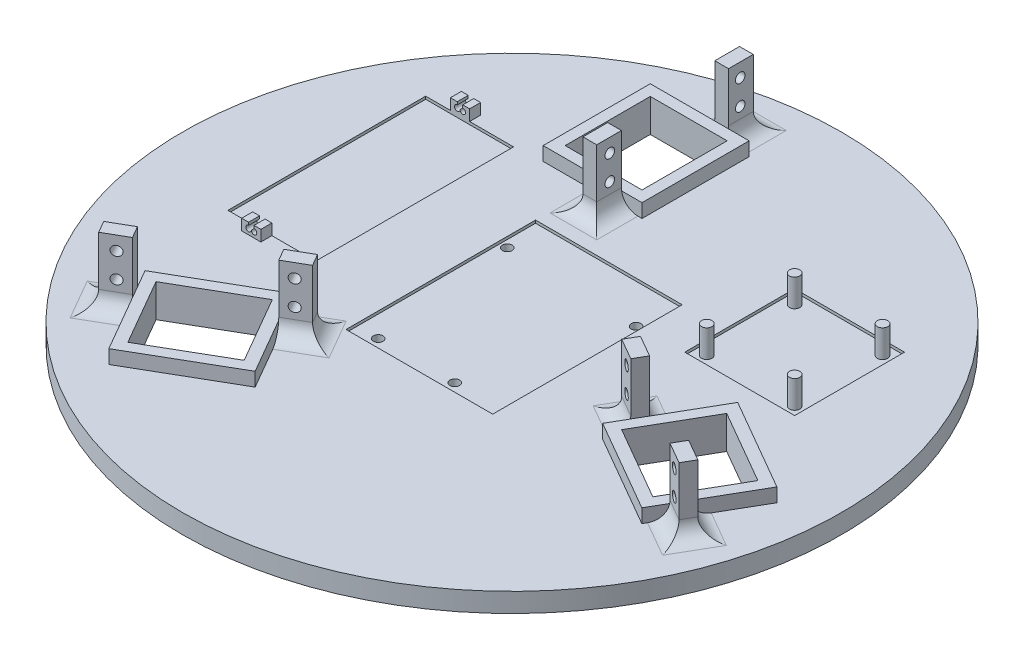
from build123d import *

# Parameters (mm, degrees)
SKETCH1_R                = 120
BOSS_EXTRUDE1_DEPTH      = 7
SKETCH2_W                = 32
SKETCH2_H                = 72
SKETCH2_W_2              = 53.4
SKETCH2_H_2              = 69
SKETCH2_W_3              = 40
SKETCH2_H_3              = 40
CUT_EXTRUDE3_DEPTH       = 1
SKETCH2_5_W              = 36
SKETCH2_5_H              = 39
BOSS_EXTRUDE2_DEPTH      = 5
BOSS_EXTRUDE3_DEPTH      = 24
FILLET1_R                = 6
CUT_EXTRUDE4_REACH       = 195.107
SKETCH4_R                = 1.75
SKETCH2_6_W              = 7
SKETCH2_6_H              = 4
BOSS_EXTRUDE4_DEPTH      = 3
CUT_EXTRUDE7_REACH       = 220.211
SKETCH11_W               = 2.500006305
SKETCH11_H               = 4
SKETCH11_W_2             = 2.500003153
BOSS_EXTRUDE5_DEPTH      = 1
SKETCH12_R               = 1.9
BOSS_EXTRUDE6_DEPTH      = 10
CUT_EXTRUDE8_DEPTH       = 172.394282285
CUT_EXTRUDE8_DEPTH_BACK  = 172.394282285
SKETCH13_W               = 28
SKETCH13_H               = 31
CIRPATTERN2_COUNT        = 3
FILLET1_OF_CIRPATTERN2_R = 6
SKETCH15_R               = 1.75
CUT_EXTRUDE9_DEPTH       = 172.537167984
CUT_EXTRUDE10_START      = -6
SKETCH16_W               = 53.4
SKETCH16_H               = 69
CUT_EXTRUDE10_DEPTH      = 3


with BuildPart() as part:
    # Sketch1 → Boss-Extrude1 (new body)
    with BuildSketch(Plane(origin=(0, 0, 0), x_dir=(1, 0, 0), z_dir=(0, 1, 0))):
        with Locations(Location((0, 0, 0), (0, 0, 270))):
            Circle(SKETCH1_R)
    extrude(amount=BOSS_EXTRUDE1_DEPTH)

    # Sketch2 → Cut-Extrude3 (cut)
    with BuildSketch(Plane(origin=(0, 7, 0), x_dir=(1, 0, 0), z_dir=(0, 1, 0))):
        with Locations((-71.029666422, 19.596326751)):
            Rectangle(SKETCH2_W, SKETCH2_H)
        with Locations((-1.243041985, 2.015923887)):
            Rectangle(SKETCH2_W_2, SKETCH2_H_2)
        with Locations((60.875562307, 42.044954151)):
            Rectangle(SKETCH2_W_3, SKETCH2_H_3)
    extrude(amount=-CUT_EXTRUDE3_DEPTH, mode=Mode.SUBTRACT)

    # Sketch2<5> → Boss-Extrude2 (add)
    with BuildSketch(Plane(origin=(0, 7, 0), x_dir=(1, 0, 0), z_dir=(0, 1, 0))):
        with Locations((-27.05, 75.897838026)):
            Rectangle(SKETCH2_5_W, SKETCH2_5_H)
        Polygon((-60.091951196, -86.713363453), (-78.091951196, -55.536448917), (-44.316960449, -36.036448917), (-26.316960449, -67.213363453), align=None)
        Polygon((105.141951196, -8.684474572), (87.141951196, -39.861389109), (53.366960449, -20.361389109), (71.366960449, 10.815525428), align=None)
    extrude(amount=BOSS_EXTRUDE2_DEPTH)

    # Sketch3 → Boss-Extrude3 (add)
    with BuildSketch(Plane(origin=(0, 7, 0), x_dir=(1, 0, 0), z_dir=(0, 1, 0))):
        Polygon((-74.341951196, -62.031639446), (-82.136179831, -66.531639446), (-79.636179831, -70.861766464), (-71.841951196, -66.361766464), align=None)
        Polygon((-40.566960449, -42.531639446), (-32.772731815, -38.031639446), (-30.272731815, -42.361766464), (-38.066960449, -46.861766464), align=None)
    boss_extrude3 = extrude(amount=BOSS_EXTRUDE3_DEPTH)

    # Fillet1
    # the kernel refuses this fillet: 6 mm, written as the material it adds along each edge
    with BuildSketch(Plane(origin=(-30.272731815, 7, 42.361766464), x_dir=(0.4999999999999997, 0, 0.8660254037844387), z_dir=(-0.8660254037844388, 0, 0.4999999999999998)), Plane(origin=(-40.566960449, 7, 42.531639446), x_dir=(-0.500000000000001, 0, -0.866025403784438), z_dir=(0.8660254037844382, 0, -0.500000000000001))) as fillet1_piece_1:
        with BuildLine():
            CenterArc((FILLET1_R, FILLET1_R), FILLET1_R, 180, 90)
            Line((0, FILLET1_R), (-FILLET1_R * 0.02, FILLET1_R))
            Line((-FILLET1_R * 0.02, FILLET1_R), (-FILLET1_R * 0.02, -FILLET1_R * 0.02))
            Line((-FILLET1_R * 0.02, -FILLET1_R * 0.02), (FILLET1_R, -FILLET1_R * 0.02))
            Line((FILLET1_R, -FILLET1_R * 0.02), (FILLET1_R, 0))
        make_face()
    extrude(amount=9)
    with BuildSketch(Plane(origin=(-32.772731815, 7, 38.031639446), x_dir=(0.8660254037844393, 0, -0.49999999999999895), z_dir=(0.499999999999999, 0, 0.8660254037844393))) as fillet1_piece_2:
        with BuildLine():
            CenterArc((FILLET1_R, FILLET1_R), FILLET1_R, 180, 90)
            Line((0, FILLET1_R), (-FILLET1_R * 0.02, FILLET1_R))
            Line((-FILLET1_R * 0.02, FILLET1_R), (-FILLET1_R * 0.02, -FILLET1_R * 0.02))
            Line((-FILLET1_R * 0.02, -FILLET1_R * 0.02), (FILLET1_R, -FILLET1_R * 0.02))
            Line((FILLET1_R, -FILLET1_R * 0.02), (FILLET1_R, 0))
        make_face()
    extrude(amount=5)
    with BuildSketch(Plane(origin=(-74.341951196, 7, 62.031639446), x_dir=(-0.5000000000000006, 0, -0.8660254037844384), z_dir=(-0.8660254037844384, 0, 0.5000000000000006)), Plane(origin=(-79.636179831, 7, 70.861766464), x_dir=(0.5, 0, 0.8660254037844387), z_dir=(0.8660254037844387, 0, -0.5))) as fillet1_piece_3:
        with BuildLine():
            CenterArc((FILLET1_R, -FILLET1_R), FILLET1_R, 90, 90)
            Line((0, -FILLET1_R), (-FILLET1_R * 0.02, -FILLET1_R))
            Line((-FILLET1_R * 0.02, -FILLET1_R), (-FILLET1_R * 0.02, FILLET1_R * 0.02))
            Line((-FILLET1_R * 0.02, FILLET1_R * 0.02), (FILLET1_R, FILLET1_R * 0.02))
            Line((FILLET1_R, FILLET1_R * 0.02), (FILLET1_R, 0))
        make_face()
    extrude(amount=9)
    with BuildSketch(Plane(origin=(-82.136179831, 7, 66.531639446), x_dir=(-0.8660254037844376, 0, 0.5000000000000018), z_dir=(0.5000000000000018, 0, 0.8660254037844377))) as fillet1_piece_4:
        with BuildLine():
            CenterArc((FILLET1_R, -FILLET1_R), FILLET1_R, 90, 90)
            Line((0, -FILLET1_R), (-FILLET1_R * 0.02, -FILLET1_R))
            Line((-FILLET1_R * 0.02, -FILLET1_R), (-FILLET1_R * 0.02, FILLET1_R * 0.02))
            Line((-FILLET1_R * 0.02, FILLET1_R * 0.02), (FILLET1_R, FILLET1_R * 0.02))
            Line((FILLET1_R, FILLET1_R * 0.02), (FILLET1_R, 0))
        make_face()
    extrude(amount=5)
    with BuildSketch(Plane(origin=(-17.282350758, 7, 34.861766464), x_dir=(0.4999999999999997, 0, 0.8660254037844388), z_dir=(-0.8660254037844388, 0, 0.4999999999999998))) as fillet1_piece_5a_section:
        with BuildLine():
            CenterArc((FILLET1_R, FILLET1_R), FILLET1_R, 180, 90)
            Line((0, FILLET1_R), (-FILLET1_R * 0.02, FILLET1_R))
            Line((-FILLET1_R * 0.02, FILLET1_R), (-FILLET1_R * 0.02, -FILLET1_R * 0.02))
            Line((-FILLET1_R * 0.02, -FILLET1_R * 0.02), (FILLET1_R, -FILLET1_R * 0.02))
            Line((FILLET1_R, -FILLET1_R * 0.02), (FILLET1_R, 0))
        make_face()
    fillet1_piece_5a = extrude(amount=24, mode=Mode.PRIVATE)
    fillet1_piece_5a = split(fillet1_piece_5a, bisect_by=Plane(origin=(-29.593546472, 8.358370686, 43.538149986), z_dir=(0.8660254037844393, 0, -0.499999999999999)), keep=Keep.TOP, mode=Mode.PRIVATE)
    with BuildSketch(Plane(origin=(-32.772731815, 7, 38.031639446), x_dir=(0.8660254037844393, 0, -0.49999999999999895), z_dir=(0.499999999999999, 0, 0.8660254037844393))) as fillet1_piece_5b_section:
        with BuildLine():
            CenterArc((FILLET1_R, FILLET1_R), FILLET1_R, 180, 90)
            Line((0, FILLET1_R), (-FILLET1_R * 0.02, FILLET1_R))
            Line((-FILLET1_R * 0.02, FILLET1_R), (-FILLET1_R * 0.02, -FILLET1_R * 0.02))
            Line((-FILLET1_R * 0.02, -FILLET1_R * 0.02), (FILLET1_R, -FILLET1_R * 0.02))
            Line((FILLET1_R, -FILLET1_R * 0.02), (FILLET1_R, 0))
        make_face()
    fillet1_piece_5b = extrude(amount=20, mode=Mode.PRIVATE)
    fillet1_piece_5b = split(fillet1_piece_5b, bisect_by=Plane(origin=(-29.096348293, 8.358370686, 41.682581122), z_dir=(0.4999999999999998, 0, 0.8660254037844388)), keep=Keep.TOP, mode=Mode.PRIVATE)
    fillet1_piece_5 = fillet1_piece_5a & fillet1_piece_5b
    add(fillet1_piece_5)
    with BuildSketch(Plane(origin=(-40.272731815, 7, 25.041258389), x_dir=(0.8660254037844392, 0, -0.4999999999999989), z_dir=(0.499999999999999, 0, 0.8660254037844393))) as fillet1_piece_6a_section:
        with BuildLine():
            CenterArc((FILLET1_R, FILLET1_R), FILLET1_R, 180, 90)
            Line((0, FILLET1_R), (-FILLET1_R * 0.02, FILLET1_R))
            Line((-FILLET1_R * 0.02, FILLET1_R), (-FILLET1_R * 0.02, -FILLET1_R * 0.02))
            Line((-FILLET1_R * 0.02, -FILLET1_R * 0.02), (FILLET1_R, -FILLET1_R * 0.02))
            Line((FILLET1_R, -FILLET1_R * 0.02), (FILLET1_R, 0))
        make_face()
    fillet1_piece_6a = extrude(amount=20, mode=Mode.PRIVATE)
    fillet1_piece_6a = split(fillet1_piece_6a, bisect_by=Plane(origin=(-31.596348293, 8.358370686, 37.352454103), z_dir=(-0.500000000000001, 0, -0.8660254037844382)), keep=Keep.TOP, mode=Mode.PRIVATE)
    with BuildSketch(Plane(origin=(-40.566960449, 7, 42.531639446), x_dir=(-0.500000000000001, 0, -0.866025403784438), z_dir=(0.8660254037844382, 0, -0.500000000000001))) as fillet1_piece_6b_section:
        with BuildLine():
            CenterArc((FILLET1_R, FILLET1_R), FILLET1_R, 180, 90)
            Line((0, FILLET1_R), (-FILLET1_R * 0.02, FILLET1_R))
            Line((-FILLET1_R * 0.02, FILLET1_R), (-FILLET1_R * 0.02, -FILLET1_R * 0.02))
            Line((-FILLET1_R * 0.02, -FILLET1_R * 0.02), (FILLET1_R, -FILLET1_R * 0.02))
            Line((FILLET1_R, -FILLET1_R * 0.02), (FILLET1_R, 0))
        make_face()
    fillet1_piece_6b = extrude(amount=24, mode=Mode.PRIVATE)
    fillet1_piece_6b = split(fillet1_piece_6b, bisect_by=Plane(origin=(-33.451917158, 8.358370686, 36.855255924), z_dir=(0.8660254037844393, 0, -0.499999999999999)), keep=Keep.TOP, mode=Mode.PRIVATE)
    fillet1_piece_6 = fillet1_piece_6a & fillet1_piece_6b
    add(fillet1_piece_6)
    with BuildSketch(Plane(origin=(-74.341951196, 7, 62.031639446), x_dir=(-0.5000000000000006, 0, -0.8660254037844384), z_dir=(-0.8660254037844384, 0, 0.5000000000000006))) as fillet1_piece_7a_section:
        with BuildLine():
            CenterArc((FILLET1_R, -FILLET1_R), FILLET1_R, 90, 90)
            Line((0, -FILLET1_R), (-FILLET1_R * 0.02, -FILLET1_R))
            Line((-FILLET1_R * 0.02, -FILLET1_R), (-FILLET1_R * 0.02, FILLET1_R * 0.02))
            Line((-FILLET1_R * 0.02, FILLET1_R * 0.02), (FILLET1_R, FILLET1_R * 0.02))
            Line((FILLET1_R, FILLET1_R * 0.02), (FILLET1_R, 0))
        make_face()
    fillet1_piece_7a = extrude(amount=24, mode=Mode.PRIVATE)
    fillet1_piece_7a = split(fillet1_piece_7a, bisect_by=Plane(origin=(-82.815365173, 8.358370686, 65.355255924), z_dir=(-0.8660254037844377, 0, 0.5000000000000018)), keep=Keep.TOP, mode=Mode.PRIVATE)
    with BuildSketch(Plane(origin=(-89.636179831, 7, 53.541258389), x_dir=(-0.8660254037844376, 0, 0.5000000000000017), z_dir=(0.5000000000000018, 0, 0.8660254037844377))) as fillet1_piece_7b_section:
        with BuildLine():
            CenterArc((FILLET1_R, -FILLET1_R), FILLET1_R, 90, 90)
            Line((0, -FILLET1_R), (-FILLET1_R * 0.02, -FILLET1_R))
            Line((-FILLET1_R * 0.02, -FILLET1_R), (-FILLET1_R * 0.02, FILLET1_R * 0.02))
            Line((-FILLET1_R * 0.02, FILLET1_R * 0.02), (FILLET1_R, FILLET1_R * 0.02))
            Line((FILLET1_R, FILLET1_R * 0.02), (FILLET1_R, 0))
        make_face()
    fillet1_piece_7b = extrude(amount=20, mode=Mode.PRIVATE)
    fillet1_piece_7b = split(fillet1_piece_7b, bisect_by=Plane(origin=(-83.312563352, 8.358370686, 67.210824788), z_dir=(-0.5000000000000006, 0, -0.8660254037844384)), keep=Keep.TOP, mode=Mode.PRIVATE)
    fillet1_piece_7 = fillet1_piece_7a & fillet1_piece_7b
    add(fillet1_piece_7)
    with BuildSketch(Plane(origin=(-82.136179831, 7, 66.531639446), x_dir=(-0.8660254037844376, 0, 0.5000000000000018), z_dir=(0.5000000000000018, 0, 0.8660254037844377))) as fillet1_piece_8a_section:
        with BuildLine():
            CenterArc((FILLET1_R, -FILLET1_R), FILLET1_R, 90, 90)
            Line((0, -FILLET1_R), (-FILLET1_R * 0.02, -FILLET1_R))
            Line((-FILLET1_R * 0.02, -FILLET1_R), (-FILLET1_R * 0.02, FILLET1_R * 0.02))
            Line((-FILLET1_R * 0.02, FILLET1_R * 0.02), (FILLET1_R, FILLET1_R * 0.02))
            Line((FILLET1_R, FILLET1_R * 0.02), (FILLET1_R, 0))
        make_face()
    fillet1_piece_8a = extrude(amount=20, mode=Mode.PRIVATE)
    fillet1_piece_8a = split(fillet1_piece_8a, bisect_by=Plane(origin=(-80.812563352, 8.358370686, 71.540951807), z_dir=(0.5, 0, 0.8660254037844387)), keep=Keep.TOP, mode=Mode.PRIVATE)
    with BuildSketch(Plane(origin=(-92.626560887, 7, 78.361766464), x_dir=(0.5, 0, 0.8660254037844387), z_dir=(0.8660254037844387, 0, -0.5))) as fillet1_piece_8b_section:
        with BuildLine():
            CenterArc((FILLET1_R, -FILLET1_R), FILLET1_R, 90, 90)
            Line((0, -FILLET1_R), (-FILLET1_R * 0.02, -FILLET1_R))
            Line((-FILLET1_R * 0.02, -FILLET1_R), (-FILLET1_R * 0.02, FILLET1_R * 0.02))
            Line((-FILLET1_R * 0.02, FILLET1_R * 0.02), (FILLET1_R, FILLET1_R * 0.02))
            Line((FILLET1_R, FILLET1_R * 0.02), (FILLET1_R, 0))
        make_face()
    fillet1_piece_8b = extrude(amount=24, mode=Mode.PRIVATE)
    fillet1_piece_8b = split(fillet1_piece_8b, bisect_by=Plane(origin=(-78.956994488, 8.358370686, 72.038149986), z_dir=(-0.8660254037844377, 0, 0.5000000000000018)), keep=Keep.TOP, mode=Mode.PRIVATE)
    fillet1_piece_8 = fillet1_piece_8a & fillet1_piece_8b
    add(fillet1_piece_8)

    # Sketch4 → Cut-Extrude4 (cut, up to next)
    with BuildSketch(Plane(origin=(10.775, 0, 18.662847452), x_dir=(0.8660254037844384, 0, -0.5000000000000006), z_dir=(0.5000000000000006, 0, 0.8660254037844385)), mode=Mode.PRIVATE) as cut_extrude4_sk1:
        with Locations((-52.147838026, 26)):
            Circle(SKETCH4_R)
    cut_extrude4_tool1 = extrude(cut_extrude4_sk1.sketch, amount=-CUT_EXTRUDE4_REACH, mode=Mode.PRIVATE) & part.part
    # Sketch4 → Cut-Extrude4 (cut, up to next)
    with BuildSketch(Plane(origin=(10.775, 0, 18.662847452), x_dir=(0.8660254037844384, 0, -0.5000000000000006), z_dir=(0.5000000000000006, 0, 0.8660254037844385)), mode=Mode.PRIVATE) as cut_extrude4_sk2:
        with Locations((-52.147838026, 17)):
            Circle(SKETCH4_R)
    cut_extrude4_tool2 = extrude(cut_extrude4_sk2.sketch, amount=-CUT_EXTRUDE4_REACH, mode=Mode.PRIVATE) & part.part
    # Sketch4 → Cut-Extrude4 (cut, up to next)
    with BuildSketch(Plane(origin=(10.775, 0, 18.662847452), x_dir=(0.8660254037844384, 0, -0.5000000000000006), z_dir=(0.5000000000000006, 0, 0.8660254037844385)), mode=Mode.PRIVATE) as cut_extrude4_sk3:
        with Locations((-99.647838026, 26)):
            Circle(SKETCH4_R)
    cut_extrude4_tool3 = extrude(cut_extrude4_sk3.sketch, amount=-CUT_EXTRUDE4_REACH, mode=Mode.PRIVATE) & part.part
    # Sketch4 → Cut-Extrude4 (cut, up to next)
    with BuildSketch(Plane(origin=(10.775, 0, 18.662847452), x_dir=(0.8660254037844384, 0, -0.5000000000000006), z_dir=(0.5000000000000006, 0, 0.8660254037844385)), mode=Mode.PRIVATE) as cut_extrude4_sk4:
        with Locations((-99.647838026, 17)):
            Circle(SKETCH4_R)
    cut_extrude4_tool4 = extrude(cut_extrude4_sk4.sketch, amount=-CUT_EXTRUDE4_REACH, mode=Mode.PRIVATE) & part.part
    cut_extrude4_1 = cut_extrude4_tool1.solids().sort_by_distance((-34.386352, 26, 44.736766))[0]
    add(cut_extrude4_1, mode=Mode.SUBTRACT)
    cut_extrude4_2 = cut_extrude4_tool2.solids().sort_by_distance((-34.386352, 17, 44.736766))[0]
    add(cut_extrude4_2, mode=Mode.SUBTRACT)
    cut_extrude4_3 = cut_extrude4_tool3.solids().sort_by_distance((-75.522559, 26, 68.486766))[0]
    add(cut_extrude4_3, mode=Mode.SUBTRACT)
    cut_extrude4_4 = cut_extrude4_tool4.solids().sort_by_distance((-75.522559, 17, 68.486766))[0]
    add(cut_extrude4_4, mode=Mode.SUBTRACT)
    cut_extrude4 = cut_extrude4_1 + cut_extrude4_2 + cut_extrude4_3 + cut_extrude4_4  # Cut-Extrude4 as one shape, for the pattern or mirror that repeats it

    # Sketch2<6> → Boss-Extrude4 (add)
    with BuildSketch(Plane(origin=(0, 7, 0), x_dir=(1, 0, 0), z_dir=(0, 1, 0))):
        with Locations((-74.529666422, 57.596326751)):
            Rectangle(SKETCH2_6_W, SKETCH2_6_H)
        with Locations((-74.529666422, -18.403673249)):
            Rectangle(SKETCH2_6_W, SKETCH2_6_H)
    extrude(amount=BOSS_EXTRUDE4_DEPTH)

    # Cut-Extrude7: up to this face of the body (flat: up to its plane)
    cut_extrude7_end = Plane(part.part.faces().sort_by_distance((-74.529666422, 8.5, 20.403673249))[0])
    # Sketch10 → Cut-Extrude7 (cut, up to the picked face)
    with BuildSketch(Plane(origin=(0, 0, -59.596326751), x_dir=(-1, 0, 0), z_dir=(0, 0, -1)), mode=Mode.PRIVATE) as cut_extrude7_sk1:
        with BuildLine():
            Line((73.529672727, 10), (75.529660117, 10))
            ThreePointArc((75.529660117, 10), (76.238021266, 8.294149816), (74.529666422, 8.996448965))
            ThreePointArc((74.529666422, 8.996448965), (72.821311578, 8.294149816), (73.529672727, 10))
        make_face()
    cut_extrude7_tool1 = split(extrude(cut_extrude7_sk1.sketch, amount=-CUT_EXTRUDE7_REACH, mode=Mode.PRIVATE), bisect_by=cut_extrude7_end, keep=Keep.BOTH, mode=Mode.PRIVATE)
    add(cut_extrude7_tool1.solids().sort_by(Axis((-74.529666, 9.049659, -59.596327), (0, 0, 1)))[0], mode=Mode.SUBTRACT)

    # Sketch11 → Boss-Extrude5 (add)
    with BuildSketch(Plane(origin=(0, 10, 0), x_dir=(1, 0, 0), z_dir=(0, 1, 0))):
        with Locations((-76.77966327, 57.596326751)):
            Rectangle(SKETCH11_W, SKETCH11_H)
        with Locations((-72.279667999, 57.596326751)):
            Rectangle(SKETCH11_W_2, SKETCH11_H)
        with Locations((-72.279669575, -18.403673249)):
            Rectangle(SKETCH11_W, SKETCH11_H)
        with Locations((-76.77966327, -18.403673249)):
            Rectangle(SKETCH11_W, SKETCH11_H)
    extrude(amount=BOSS_EXTRUDE5_DEPTH)

    # Sketch12 → Boss-Extrude6 (add)
    with BuildSketch(Plane(origin=(0, 6, 0), x_dir=(1, 0, 0), z_dir=(0, 1, 0))):
        with Locations(Location((44.875562307, 58.044954151, 0), (0, 0, 270))):
            Circle(SKETCH12_R)
        with Locations(Location((76.875562307, 58.044954151, 0), (0, 0, 270))):
            Circle(SKETCH12_R)
        with Locations(Location((76.875562307, 26.044954151, 0), (0, 0, 90))):
            Circle(SKETCH12_R)
        with Locations(Location((44.875562307, 26.044954151, 0), (0, 0, 90))):
            Circle(SKETCH12_R)
    extrude(amount=BOSS_EXTRUDE6_DEPTH)

    # Sketch13 → Cut-Extrude8 (cut, two sides: drawn at the far end of the back side and taken through both)
    with BuildSketch(Plane(origin=(0, 7, 0), x_dir=(1, 0, 0), z_dir=(0, 1, 0)).offset(-CUT_EXTRUDE8_DEPTH_BACK)):
        Polygon((99.677849581, -10.148576188), (72.831062064, 5.351423812), (58.831062064, -18.897287494), (85.677849581, -34.397287494), align=None)
        with Locations((-27.05, 75.897838026)):
            Rectangle(SKETCH13_W, SKETCH13_H)
        Polygon((-58.627849581, -81.249261838), (-31.781062064, -65.749261838), (-45.781062064, -41.500550532), (-72.627849581, -57.000550532), align=None)
    extrude(amount=CUT_EXTRUDE8_DEPTH + CUT_EXTRUDE8_DEPTH_BACK, mode=Mode.SUBTRACT)

    # CirPattern2: Boss-Extrude3, Cut-Extrude4 ×3 about axis
    cirpattern2_axis = Axis((0, 0, 0), (0, 1, 0))
    add([boss_extrude3.rotate(cirpattern2_axis, i * 360 / CIRPATTERN2_COUNT) for i in range(1, CIRPATTERN2_COUNT)])
    add([cut_extrude4.rotate(cirpattern2_axis, i * 360 / CIRPATTERN2_COUNT) for i in range(1, CIRPATTERN2_COUNT)], mode=Mode.SUBTRACT)

    # Fillet1 of CirPattern2
    # the kernel refuses this fillet: 6 mm, written as the material it adds along each edge
    with BuildSketch(Plane(origin=(51.822731815, 7, 5.036071561), x_dir=(0.5000000000000004, 0, -0.8660254037844385), z_dir=(0.8660254037844385, 0, 0.5000000000000004)), Plane(origin=(57.116960449, 7, 13.86619858), x_dir=(-0.49999999999999933, 0, 0.866025403784439), z_dir=(-0.8660254037844392, 0, -0.4999999999999993)), Plane(origin=(-21.55, 7, -47.397838026), x_dir=(-1, 0, 0), z_dir=(0, 0, -1)), Plane(origin=(-16.55, 7, -56.397838026), x_dir=(1, 0, 0), z_dir=(0, 0, 1))) as fillet1_of_cirpattern2_piece_1:
        with BuildLine():
            CenterArc((FILLET1_OF_CIRPATTERN2_R, FILLET1_OF_CIRPATTERN2_R), FILLET1_OF_CIRPATTERN2_R, 180, 90)
            Line((0, FILLET1_OF_CIRPATTERN2_R), (-FILLET1_OF_CIRPATTERN2_R * 0.02, FILLET1_OF_CIRPATTERN2_R))
            Line((-FILLET1_OF_CIRPATTERN2_R * 0.02, FILLET1_OF_CIRPATTERN2_R), (-FILLET1_OF_CIRPATTERN2_R * 0.02, -FILLET1_OF_CIRPATTERN2_R * 0.02))
            Line((-FILLET1_OF_CIRPATTERN2_R * 0.02, -FILLET1_OF_CIRPATTERN2_R * 0.02), (FILLET1_OF_CIRPATTERN2_R, -FILLET1_OF_CIRPATTERN2_R * 0.02))
            Line((FILLET1_OF_CIRPATTERN2_R, -FILLET1_OF_CIRPATTERN2_R * 0.02), (FILLET1_OF_CIRPATTERN2_R, 0))
        make_face()
    extrude(amount=9)
    with BuildSketch(Plane(origin=(49.322731815, 7, 9.36619858), x_dir=(-0.866025403784438, 0, -0.5000000000000012), z_dir=(0.5000000000000012, 0, -0.866025403784438)), Plane(origin=(-16.55, 7, -47.397838026), x_dir=(0, 0, 1), z_dir=(-1, 0, 0))) as fillet1_of_cirpattern2_piece_2:
        with BuildLine():
            CenterArc((FILLET1_OF_CIRPATTERN2_R, FILLET1_OF_CIRPATTERN2_R), FILLET1_OF_CIRPATTERN2_R, 180, 90)
            Line((0, FILLET1_OF_CIRPATTERN2_R), (-FILLET1_OF_CIRPATTERN2_R * 0.02, FILLET1_OF_CIRPATTERN2_R))
            Line((-FILLET1_OF_CIRPATTERN2_R * 0.02, FILLET1_OF_CIRPATTERN2_R), (-FILLET1_OF_CIRPATTERN2_R * 0.02, -FILLET1_OF_CIRPATTERN2_R * 0.02))
            Line((-FILLET1_OF_CIRPATTERN2_R * 0.02, -FILLET1_OF_CIRPATTERN2_R * 0.02), (FILLET1_OF_CIRPATTERN2_R, -FILLET1_OF_CIRPATTERN2_R * 0.02))
            Line((FILLET1_OF_CIRPATTERN2_R, -FILLET1_OF_CIRPATTERN2_R * 0.02), (FILLET1_OF_CIRPATTERN2_R, 0))
        make_face()
    extrude(amount=5)
    with BuildSketch(Plane(origin=(90.891951196, 7, 33.36619858), x_dir=(-0.4999999999999996, 0, 0.8660254037844388), z_dir=(0.8660254037844389, 0, 0.49999999999999967)), Plane(origin=(101.186179831, 7, 33.536071561), x_dir=(0.5000000000000001, 0, -0.8660254037844385), z_dir=(-0.8660254037844386, 0, -0.5000000000000002)), Plane(origin=(-16.55, 7, -95.397838026), x_dir=(1, 0, 0), z_dir=(0, 0, -1)), Plane(origin=(-21.55, 7, -104.397838026), x_dir=(-1, 0, 0), z_dir=(0, 0, 1))) as fillet1_of_cirpattern2_piece_3:
        with BuildLine():
            CenterArc((FILLET1_OF_CIRPATTERN2_R, -FILLET1_OF_CIRPATTERN2_R), FILLET1_OF_CIRPATTERN2_R, 90, 90)
            Line((0, -FILLET1_OF_CIRPATTERN2_R), (-FILLET1_OF_CIRPATTERN2_R * 0.02, -FILLET1_OF_CIRPATTERN2_R))
            Line((-FILLET1_OF_CIRPATTERN2_R * 0.02, -FILLET1_OF_CIRPATTERN2_R), (-FILLET1_OF_CIRPATTERN2_R * 0.02, FILLET1_OF_CIRPATTERN2_R * 0.02))
            Line((-FILLET1_OF_CIRPATTERN2_R * 0.02, FILLET1_OF_CIRPATTERN2_R * 0.02), (FILLET1_OF_CIRPATTERN2_R, FILLET1_OF_CIRPATTERN2_R * 0.02))
            Line((FILLET1_OF_CIRPATTERN2_R, FILLET1_OF_CIRPATTERN2_R * 0.02), (FILLET1_OF_CIRPATTERN2_R, 0))
        make_face()
    extrude(amount=9)
    with BuildSketch(Plane(origin=(98.686179831, 7, 37.86619858), x_dir=(0.8660254037844395, 0, 0.4999999999999984), z_dir=(0.49999999999999845, 0, -0.8660254037844396)), Plane(origin=(-16.55, 7, -104.397838026), x_dir=(0, 0, -1), z_dir=(-1, 0, 0))) as fillet1_of_cirpattern2_piece_4:
        with BuildLine():
            CenterArc((FILLET1_OF_CIRPATTERN2_R, -FILLET1_OF_CIRPATTERN2_R), FILLET1_OF_CIRPATTERN2_R, 90, 90)
            Line((0, -FILLET1_OF_CIRPATTERN2_R), (-FILLET1_OF_CIRPATTERN2_R * 0.02, -FILLET1_OF_CIRPATTERN2_R))
            Line((-FILLET1_OF_CIRPATTERN2_R * 0.02, -FILLET1_OF_CIRPATTERN2_R), (-FILLET1_OF_CIRPATTERN2_R * 0.02, FILLET1_OF_CIRPATTERN2_R * 0.02))
            Line((-FILLET1_OF_CIRPATTERN2_R * 0.02, FILLET1_OF_CIRPATTERN2_R * 0.02), (FILLET1_OF_CIRPATTERN2_R, FILLET1_OF_CIRPATTERN2_R * 0.02))
            Line((FILLET1_OF_CIRPATTERN2_R, FILLET1_OF_CIRPATTERN2_R * 0.02), (FILLET1_OF_CIRPATTERN2_R, 0))
        make_face()
    extrude(amount=5)
    with BuildSketch(Plane(origin=(38.832350758, 7, -2.463928439), x_dir=(0.5000000000000004, 0, -0.8660254037844385), z_dir=(0.8660254037844385, 0, 0.5000000000000004))) as fillet1_of_cirpattern2_piece_5a_section:
        with BuildLine():
            CenterArc((FILLET1_OF_CIRPATTERN2_R, FILLET1_OF_CIRPATTERN2_R), FILLET1_OF_CIRPATTERN2_R, 180, 90)
            Line((0, FILLET1_OF_CIRPATTERN2_R), (-FILLET1_OF_CIRPATTERN2_R * 0.02, FILLET1_OF_CIRPATTERN2_R))
            Line((-FILLET1_OF_CIRPATTERN2_R * 0.02, FILLET1_OF_CIRPATTERN2_R), (-FILLET1_OF_CIRPATTERN2_R * 0.02, -FILLET1_OF_CIRPATTERN2_R * 0.02))
            Line((-FILLET1_OF_CIRPATTERN2_R * 0.02, -FILLET1_OF_CIRPATTERN2_R * 0.02), (FILLET1_OF_CIRPATTERN2_R, -FILLET1_OF_CIRPATTERN2_R * 0.02))
            Line((FILLET1_OF_CIRPATTERN2_R, -FILLET1_OF_CIRPATTERN2_R * 0.02), (FILLET1_OF_CIRPATTERN2_R, 0))
        make_face()
    fillet1_of_cirpattern2_piece_5a = extrude(amount=24, mode=Mode.PRIVATE)
    fillet1_of_cirpattern2_piece_5a = split(fillet1_of_cirpattern2_piece_5a, bisect_by=Plane(origin=(52.501917158, 8.358370686, 3.85968804), z_dir=(-0.866025403784438, 0, -0.5000000000000012)), keep=Keep.TOP, mode=Mode.PRIVATE)
    with BuildSketch(Plane(origin=(49.322731815, 7, 9.36619858), x_dir=(-0.866025403784438, 0, -0.5000000000000012), z_dir=(0.5000000000000012, 0, -0.866025403784438))) as fillet1_of_cirpattern2_piece_5b_section:
        with BuildLine():
            CenterArc((FILLET1_OF_CIRPATTERN2_R, FILLET1_OF_CIRPATTERN2_R), FILLET1_OF_CIRPATTERN2_R, 180, 90)
            Line((0, FILLET1_OF_CIRPATTERN2_R), (-FILLET1_OF_CIRPATTERN2_R * 0.02, FILLET1_OF_CIRPATTERN2_R))
            Line((-FILLET1_OF_CIRPATTERN2_R * 0.02, FILLET1_OF_CIRPATTERN2_R), (-FILLET1_OF_CIRPATTERN2_R * 0.02, -FILLET1_OF_CIRPATTERN2_R * 0.02))
            Line((-FILLET1_OF_CIRPATTERN2_R * 0.02, -FILLET1_OF_CIRPATTERN2_R * 0.02), (FILLET1_OF_CIRPATTERN2_R, -FILLET1_OF_CIRPATTERN2_R * 0.02))
            Line((FILLET1_OF_CIRPATTERN2_R, -FILLET1_OF_CIRPATTERN2_R * 0.02), (FILLET1_OF_CIRPATTERN2_R, 0))
        make_face()
    fillet1_of_cirpattern2_piece_5b = extrude(amount=20, mode=Mode.PRIVATE)
    fillet1_of_cirpattern2_piece_5b = split(fillet1_of_cirpattern2_piece_5b, bisect_by=Plane(origin=(50.646348293, 8.358370686, 4.356886219), z_dir=(0.5000000000000004, 0, -0.8660254037844384)), keep=Keep.TOP, mode=Mode.PRIVATE)
    fillet1_of_cirpattern2_piece_5 = fillet1_of_cirpattern2_piece_5a & fillet1_of_cirpattern2_piece_5b
    add(fillet1_of_cirpattern2_piece_5)
    with BuildSketch(Plane(origin=(41.822731815, 7, 22.356579637), x_dir=(-0.866025403784438, 0, -0.5000000000000012), z_dir=(0.5000000000000012, 0, -0.866025403784438))) as fillet1_of_cirpattern2_piece_6a_section:
        with BuildLine():
            CenterArc((FILLET1_OF_CIRPATTERN2_R, FILLET1_OF_CIRPATTERN2_R), FILLET1_OF_CIRPATTERN2_R, 180, 90)
            Line((0, FILLET1_OF_CIRPATTERN2_R), (-FILLET1_OF_CIRPATTERN2_R * 0.02, FILLET1_OF_CIRPATTERN2_R))
            Line((-FILLET1_OF_CIRPATTERN2_R * 0.02, FILLET1_OF_CIRPATTERN2_R), (-FILLET1_OF_CIRPATTERN2_R * 0.02, -FILLET1_OF_CIRPATTERN2_R * 0.02))
            Line((-FILLET1_OF_CIRPATTERN2_R * 0.02, -FILLET1_OF_CIRPATTERN2_R * 0.02), (FILLET1_OF_CIRPATTERN2_R, -FILLET1_OF_CIRPATTERN2_R * 0.02))
            Line((FILLET1_OF_CIRPATTERN2_R, -FILLET1_OF_CIRPATTERN2_R * 0.02), (FILLET1_OF_CIRPATTERN2_R, 0))
        make_face()
    fillet1_of_cirpattern2_piece_6a = extrude(amount=20, mode=Mode.PRIVATE)
    fillet1_of_cirpattern2_piece_6a = split(fillet1_of_cirpattern2_piece_6a, bisect_by=Plane(origin=(48.146348293, 8.358370686, 8.687013237), z_dir=(-0.4999999999999993, 0, 0.8660254037844392)), keep=Keep.TOP, mode=Mode.PRIVATE)
    with BuildSketch(Plane(origin=(57.116960449, 7, 13.86619858), x_dir=(-0.49999999999999933, 0, 0.866025403784439), z_dir=(-0.8660254037844392, 0, -0.4999999999999993))) as fillet1_of_cirpattern2_piece_6b_section:
        with BuildLine():
            CenterArc((FILLET1_OF_CIRPATTERN2_R, FILLET1_OF_CIRPATTERN2_R), FILLET1_OF_CIRPATTERN2_R, 180, 90)
            Line((0, FILLET1_OF_CIRPATTERN2_R), (-FILLET1_OF_CIRPATTERN2_R * 0.02, FILLET1_OF_CIRPATTERN2_R))
            Line((-FILLET1_OF_CIRPATTERN2_R * 0.02, FILLET1_OF_CIRPATTERN2_R), (-FILLET1_OF_CIRPATTERN2_R * 0.02, -FILLET1_OF_CIRPATTERN2_R * 0.02))
            Line((-FILLET1_OF_CIRPATTERN2_R * 0.02, -FILLET1_OF_CIRPATTERN2_R * 0.02), (FILLET1_OF_CIRPATTERN2_R, -FILLET1_OF_CIRPATTERN2_R * 0.02))
            Line((FILLET1_OF_CIRPATTERN2_R, -FILLET1_OF_CIRPATTERN2_R * 0.02), (FILLET1_OF_CIRPATTERN2_R, 0))
        make_face()
    fillet1_of_cirpattern2_piece_6b = extrude(amount=24, mode=Mode.PRIVATE)
    fillet1_of_cirpattern2_piece_6b = split(fillet1_of_cirpattern2_piece_6b, bisect_by=Plane(origin=(48.643546472, 8.358370686, 10.542582102), z_dir=(-0.866025403784438, 0, -0.5000000000000012)), keep=Keep.TOP, mode=Mode.PRIVATE)
    fillet1_of_cirpattern2_piece_6 = fillet1_of_cirpattern2_piece_6a & fillet1_of_cirpattern2_piece_6b
    add(fillet1_of_cirpattern2_piece_6)
    with BuildSketch(Plane(origin=(91.186179831, 7, 50.856579637), x_dir=(0.8660254037844395, 0, 0.4999999999999984), z_dir=(0.49999999999999845, 0, -0.8660254037844396))) as fillet1_of_cirpattern2_piece_7a_section:
        with BuildLine():
            CenterArc((FILLET1_OF_CIRPATTERN2_R, -FILLET1_OF_CIRPATTERN2_R), FILLET1_OF_CIRPATTERN2_R, 90, 90)
            Line((0, -FILLET1_OF_CIRPATTERN2_R), (-FILLET1_OF_CIRPATTERN2_R * 0.02, -FILLET1_OF_CIRPATTERN2_R))
            Line((-FILLET1_OF_CIRPATTERN2_R * 0.02, -FILLET1_OF_CIRPATTERN2_R), (-FILLET1_OF_CIRPATTERN2_R * 0.02, FILLET1_OF_CIRPATTERN2_R * 0.02))
            Line((-FILLET1_OF_CIRPATTERN2_R * 0.02, FILLET1_OF_CIRPATTERN2_R * 0.02), (FILLET1_OF_CIRPATTERN2_R, FILLET1_OF_CIRPATTERN2_R * 0.02))
            Line((FILLET1_OF_CIRPATTERN2_R, FILLET1_OF_CIRPATTERN2_R * 0.02), (FILLET1_OF_CIRPATTERN2_R, 0))
        make_face()
    fillet1_of_cirpattern2_piece_7a = extrude(amount=20, mode=Mode.PRIVATE)
    fillet1_of_cirpattern2_piece_7a = split(fillet1_of_cirpattern2_piece_7a, bisect_by=Plane(origin=(99.862563352, 8.358370686, 38.545383923), z_dir=(-0.4999999999999997, 0, 0.866025403784439)), keep=Keep.TOP, mode=Mode.PRIVATE)
    with BuildSketch(Plane(origin=(90.891951196, 7, 33.36619858), x_dir=(-0.4999999999999996, 0, 0.8660254037844388), z_dir=(0.8660254037844389, 0, 0.49999999999999967))) as fillet1_of_cirpattern2_piece_7b_section:
        with BuildLine():
            CenterArc((FILLET1_OF_CIRPATTERN2_R, -FILLET1_OF_CIRPATTERN2_R), FILLET1_OF_CIRPATTERN2_R, 90, 90)
            Line((0, -FILLET1_OF_CIRPATTERN2_R), (-FILLET1_OF_CIRPATTERN2_R * 0.02, -FILLET1_OF_CIRPATTERN2_R))
            Line((-FILLET1_OF_CIRPATTERN2_R * 0.02, -FILLET1_OF_CIRPATTERN2_R), (-FILLET1_OF_CIRPATTERN2_R * 0.02, FILLET1_OF_CIRPATTERN2_R * 0.02))
            Line((-FILLET1_OF_CIRPATTERN2_R * 0.02, FILLET1_OF_CIRPATTERN2_R * 0.02), (FILLET1_OF_CIRPATTERN2_R, FILLET1_OF_CIRPATTERN2_R * 0.02))
            Line((FILLET1_OF_CIRPATTERN2_R, FILLET1_OF_CIRPATTERN2_R * 0.02), (FILLET1_OF_CIRPATTERN2_R, 0))
        make_face()
    fillet1_of_cirpattern2_piece_7b = extrude(amount=24, mode=Mode.PRIVATE)
    fillet1_of_cirpattern2_piece_7b = split(fillet1_of_cirpattern2_piece_7b, bisect_by=Plane(origin=(98.006994488, 8.358370686, 39.042582102), z_dir=(0.8660254037844396, 0, 0.49999999999999845)), keep=Keep.TOP, mode=Mode.PRIVATE)
    fillet1_of_cirpattern2_piece_7 = fillet1_of_cirpattern2_piece_7a & fillet1_of_cirpattern2_piece_7b
    add(fillet1_of_cirpattern2_piece_7)
    with BuildSketch(Plane(origin=(114.176560887, 7, 41.036071561), x_dir=(0.5000000000000001, 0, -0.8660254037844385), z_dir=(-0.8660254037844386, 0, -0.5000000000000002))) as fillet1_of_cirpattern2_piece_8a_section:
        with BuildLine():
            CenterArc((FILLET1_OF_CIRPATTERN2_R, -FILLET1_OF_CIRPATTERN2_R), FILLET1_OF_CIRPATTERN2_R, 90, 90)
            Line((0, -FILLET1_OF_CIRPATTERN2_R), (-FILLET1_OF_CIRPATTERN2_R * 0.02, -FILLET1_OF_CIRPATTERN2_R))
            Line((-FILLET1_OF_CIRPATTERN2_R * 0.02, -FILLET1_OF_CIRPATTERN2_R), (-FILLET1_OF_CIRPATTERN2_R * 0.02, FILLET1_OF_CIRPATTERN2_R * 0.02))
            Line((-FILLET1_OF_CIRPATTERN2_R * 0.02, FILLET1_OF_CIRPATTERN2_R * 0.02), (FILLET1_OF_CIRPATTERN2_R, FILLET1_OF_CIRPATTERN2_R * 0.02))
            Line((FILLET1_OF_CIRPATTERN2_R, FILLET1_OF_CIRPATTERN2_R * 0.02), (FILLET1_OF_CIRPATTERN2_R, 0))
        make_face()
    fillet1_of_cirpattern2_piece_8a = extrude(amount=24, mode=Mode.PRIVATE)
    fillet1_of_cirpattern2_piece_8a = split(fillet1_of_cirpattern2_piece_8a, bisect_by=Plane(origin=(101.865365173, 8.358370686, 32.35968804), z_dir=(0.8660254037844396, 0, 0.49999999999999845)), keep=Keep.TOP, mode=Mode.PRIVATE)
    with BuildSketch(Plane(origin=(98.686179831, 7, 37.86619858), x_dir=(0.8660254037844395, 0, 0.4999999999999984), z_dir=(0.49999999999999845, 0, -0.8660254037844396))) as fillet1_of_cirpattern2_piece_8b_section:
        with BuildLine():
            CenterArc((FILLET1_OF_CIRPATTERN2_R, -FILLET1_OF_CIRPATTERN2_R), FILLET1_OF_CIRPATTERN2_R, 90, 90)
            Line((0, -FILLET1_OF_CIRPATTERN2_R), (-FILLET1_OF_CIRPATTERN2_R * 0.02, -FILLET1_OF_CIRPATTERN2_R))
            Line((-FILLET1_OF_CIRPATTERN2_R * 0.02, -FILLET1_OF_CIRPATTERN2_R), (-FILLET1_OF_CIRPATTERN2_R * 0.02, FILLET1_OF_CIRPATTERN2_R * 0.02))
            Line((-FILLET1_OF_CIRPATTERN2_R * 0.02, FILLET1_OF_CIRPATTERN2_R * 0.02), (FILLET1_OF_CIRPATTERN2_R, FILLET1_OF_CIRPATTERN2_R * 0.02))
            Line((FILLET1_OF_CIRPATTERN2_R, FILLET1_OF_CIRPATTERN2_R * 0.02), (FILLET1_OF_CIRPATTERN2_R, 0))
        make_face()
    fillet1_of_cirpattern2_piece_8b = extrude(amount=20, mode=Mode.PRIVATE)
    fillet1_of_cirpattern2_piece_8b = split(fillet1_of_cirpattern2_piece_8b, bisect_by=Plane(origin=(102.362563352, 8.358370686, 34.215256904), z_dir=(0.5000000000000002, 0, -0.8660254037844386)), keep=Keep.TOP, mode=Mode.PRIVATE)
    fillet1_of_cirpattern2_piece_8 = fillet1_of_cirpattern2_piece_8a & fillet1_of_cirpattern2_piece_8b
    add(fillet1_of_cirpattern2_piece_8)
    with BuildSketch(Plane(origin=(-21.55, 7, -32.397838026), x_dir=(-1, 0, 0), z_dir=(0, 0, -1))) as fillet1_of_cirpattern2_piece_9a_section:
        with BuildLine():
            CenterArc((FILLET1_OF_CIRPATTERN2_R, FILLET1_OF_CIRPATTERN2_R), FILLET1_OF_CIRPATTERN2_R, 180, 90)
            Line((0, FILLET1_OF_CIRPATTERN2_R), (-FILLET1_OF_CIRPATTERN2_R * 0.02, FILLET1_OF_CIRPATTERN2_R))
            Line((-FILLET1_OF_CIRPATTERN2_R * 0.02, FILLET1_OF_CIRPATTERN2_R), (-FILLET1_OF_CIRPATTERN2_R * 0.02, -FILLET1_OF_CIRPATTERN2_R * 0.02))
            Line((-FILLET1_OF_CIRPATTERN2_R * 0.02, -FILLET1_OF_CIRPATTERN2_R * 0.02), (FILLET1_OF_CIRPATTERN2_R, -FILLET1_OF_CIRPATTERN2_R * 0.02))
            Line((FILLET1_OF_CIRPATTERN2_R, -FILLET1_OF_CIRPATTERN2_R * 0.02), (FILLET1_OF_CIRPATTERN2_R, 0))
        make_face()
    fillet1_of_cirpattern2_piece_9a = extrude(amount=24, mode=Mode.PRIVATE)
    fillet1_of_cirpattern2_piece_9a = split(fillet1_of_cirpattern2_piece_9a, bisect_by=Plane(origin=(-22.908370686, 8.358370686, -47.397838026), z_dir=(0, 0, 1)), keep=Keep.TOP, mode=Mode.PRIVATE)
    with BuildSketch(Plane(origin=(-16.55, 7, -47.397838026), x_dir=(0, 0, 1), z_dir=(-1, 0, 0))) as fillet1_of_cirpattern2_piece_9b_section:
        with BuildLine():
            CenterArc((FILLET1_OF_CIRPATTERN2_R, FILLET1_OF_CIRPATTERN2_R), FILLET1_OF_CIRPATTERN2_R, 180, 90)
            Line((0, FILLET1_OF_CIRPATTERN2_R), (-FILLET1_OF_CIRPATTERN2_R * 0.02, FILLET1_OF_CIRPATTERN2_R))
            Line((-FILLET1_OF_CIRPATTERN2_R * 0.02, FILLET1_OF_CIRPATTERN2_R), (-FILLET1_OF_CIRPATTERN2_R * 0.02, -FILLET1_OF_CIRPATTERN2_R * 0.02))
            Line((-FILLET1_OF_CIRPATTERN2_R * 0.02, -FILLET1_OF_CIRPATTERN2_R * 0.02), (FILLET1_OF_CIRPATTERN2_R, -FILLET1_OF_CIRPATTERN2_R * 0.02))
            Line((FILLET1_OF_CIRPATTERN2_R, -FILLET1_OF_CIRPATTERN2_R * 0.02), (FILLET1_OF_CIRPATTERN2_R, 0))
        make_face()
    fillet1_of_cirpattern2_piece_9b = extrude(amount=20, mode=Mode.PRIVATE)
    fillet1_of_cirpattern2_piece_9b = split(fillet1_of_cirpattern2_piece_9b, bisect_by=Plane(origin=(-21.55, 8.358370686, -46.03946734), z_dir=(-1, 0, 0)), keep=Keep.TOP, mode=Mode.PRIVATE)
    fillet1_of_cirpattern2_piece_9 = fillet1_of_cirpattern2_piece_9a & fillet1_of_cirpattern2_piece_9b
    add(fillet1_of_cirpattern2_piece_9)
    with BuildSketch(Plane(origin=(-1.55, 7, -47.397838026), x_dir=(0, 0, 1), z_dir=(-1, 0, 0))) as fillet1_of_cirpattern2_piece_10a_section:
        with BuildLine():
            CenterArc((FILLET1_OF_CIRPATTERN2_R, FILLET1_OF_CIRPATTERN2_R), FILLET1_OF_CIRPATTERN2_R, 180, 90)
            Line((0, FILLET1_OF_CIRPATTERN2_R), (-FILLET1_OF_CIRPATTERN2_R * 0.02, FILLET1_OF_CIRPATTERN2_R))
            Line((-FILLET1_OF_CIRPATTERN2_R * 0.02, FILLET1_OF_CIRPATTERN2_R), (-FILLET1_OF_CIRPATTERN2_R * 0.02, -FILLET1_OF_CIRPATTERN2_R * 0.02))
            Line((-FILLET1_OF_CIRPATTERN2_R * 0.02, -FILLET1_OF_CIRPATTERN2_R * 0.02), (FILLET1_OF_CIRPATTERN2_R, -FILLET1_OF_CIRPATTERN2_R * 0.02))
            Line((FILLET1_OF_CIRPATTERN2_R, -FILLET1_OF_CIRPATTERN2_R * 0.02), (FILLET1_OF_CIRPATTERN2_R, 0))
        make_face()
    fillet1_of_cirpattern2_piece_10a = extrude(amount=20, mode=Mode.PRIVATE)
    fillet1_of_cirpattern2_piece_10a = split(fillet1_of_cirpattern2_piece_10a, bisect_by=Plane(origin=(-16.55, 8.358370686, -46.03946734), z_dir=(1, 0, 0)), keep=Keep.TOP, mode=Mode.PRIVATE)
    with BuildSketch(Plane(origin=(-16.55, 7, -56.397838026), x_dir=(1, 0, 0), z_dir=(0, 0, 1))) as fillet1_of_cirpattern2_piece_10b_section:
        with BuildLine():
            CenterArc((FILLET1_OF_CIRPATTERN2_R, FILLET1_OF_CIRPATTERN2_R), FILLET1_OF_CIRPATTERN2_R, 180, 90)
            Line((0, FILLET1_OF_CIRPATTERN2_R), (-FILLET1_OF_CIRPATTERN2_R * 0.02, FILLET1_OF_CIRPATTERN2_R))
            Line((-FILLET1_OF_CIRPATTERN2_R * 0.02, FILLET1_OF_CIRPATTERN2_R), (-FILLET1_OF_CIRPATTERN2_R * 0.02, -FILLET1_OF_CIRPATTERN2_R * 0.02))
            Line((-FILLET1_OF_CIRPATTERN2_R * 0.02, -FILLET1_OF_CIRPATTERN2_R * 0.02), (FILLET1_OF_CIRPATTERN2_R, -FILLET1_OF_CIRPATTERN2_R * 0.02))
            Line((FILLET1_OF_CIRPATTERN2_R, -FILLET1_OF_CIRPATTERN2_R * 0.02), (FILLET1_OF_CIRPATTERN2_R, 0))
        make_face()
    fillet1_of_cirpattern2_piece_10b = extrude(amount=24, mode=Mode.PRIVATE)
    fillet1_of_cirpattern2_piece_10b = split(fillet1_of_cirpattern2_piece_10b, bisect_by=Plane(origin=(-15.191629314, 8.358370686, -47.397838026), z_dir=(0, 0, 1)), keep=Keep.TOP, mode=Mode.PRIVATE)
    fillet1_of_cirpattern2_piece_10 = fillet1_of_cirpattern2_piece_10a & fillet1_of_cirpattern2_piece_10b
    add(fillet1_of_cirpattern2_piece_10)
    with BuildSketch(Plane(origin=(-16.55, 7, -95.397838026), x_dir=(1, 0, 0), z_dir=(0, 0, -1))) as fillet1_of_cirpattern2_piece_11a_section:
        with BuildLine():
            CenterArc((FILLET1_OF_CIRPATTERN2_R, -FILLET1_OF_CIRPATTERN2_R), FILLET1_OF_CIRPATTERN2_R, 90, 90)
            Line((0, -FILLET1_OF_CIRPATTERN2_R), (-FILLET1_OF_CIRPATTERN2_R * 0.02, -FILLET1_OF_CIRPATTERN2_R))
            Line((-FILLET1_OF_CIRPATTERN2_R * 0.02, -FILLET1_OF_CIRPATTERN2_R), (-FILLET1_OF_CIRPATTERN2_R * 0.02, FILLET1_OF_CIRPATTERN2_R * 0.02))
            Line((-FILLET1_OF_CIRPATTERN2_R * 0.02, FILLET1_OF_CIRPATTERN2_R * 0.02), (FILLET1_OF_CIRPATTERN2_R, FILLET1_OF_CIRPATTERN2_R * 0.02))
            Line((FILLET1_OF_CIRPATTERN2_R, FILLET1_OF_CIRPATTERN2_R * 0.02), (FILLET1_OF_CIRPATTERN2_R, 0))
        make_face()
    fillet1_of_cirpattern2_piece_11a = extrude(amount=24, mode=Mode.PRIVATE)
    fillet1_of_cirpattern2_piece_11a = split(fillet1_of_cirpattern2_piece_11a, bisect_by=Plane(origin=(-15.191629314, 8.358370686, -104.397838026), z_dir=(0, 0, -1)), keep=Keep.TOP, mode=Mode.PRIVATE)
    with BuildSketch(Plane(origin=(-1.55, 7, -104.397838026), x_dir=(0, 0, -1), z_dir=(-1, 0, 0))) as fillet1_of_cirpattern2_piece_11b_section:
        with BuildLine():
            CenterArc((FILLET1_OF_CIRPATTERN2_R, -FILLET1_OF_CIRPATTERN2_R), FILLET1_OF_CIRPATTERN2_R, 90, 90)
            Line((0, -FILLET1_OF_CIRPATTERN2_R), (-FILLET1_OF_CIRPATTERN2_R * 0.02, -FILLET1_OF_CIRPATTERN2_R))
            Line((-FILLET1_OF_CIRPATTERN2_R * 0.02, -FILLET1_OF_CIRPATTERN2_R), (-FILLET1_OF_CIRPATTERN2_R * 0.02, FILLET1_OF_CIRPATTERN2_R * 0.02))
            Line((-FILLET1_OF_CIRPATTERN2_R * 0.02, FILLET1_OF_CIRPATTERN2_R * 0.02), (FILLET1_OF_CIRPATTERN2_R, FILLET1_OF_CIRPATTERN2_R * 0.02))
            Line((FILLET1_OF_CIRPATTERN2_R, FILLET1_OF_CIRPATTERN2_R * 0.02), (FILLET1_OF_CIRPATTERN2_R, 0))
        make_face()
    fillet1_of_cirpattern2_piece_11b = extrude(amount=20, mode=Mode.PRIVATE)
    fillet1_of_cirpattern2_piece_11b = split(fillet1_of_cirpattern2_piece_11b, bisect_by=Plane(origin=(-16.55, 8.358370686, -105.756208711), z_dir=(1, 0, 0)), keep=Keep.TOP, mode=Mode.PRIVATE)
    fillet1_of_cirpattern2_piece_11 = fillet1_of_cirpattern2_piece_11a & fillet1_of_cirpattern2_piece_11b
    add(fillet1_of_cirpattern2_piece_11)
    with BuildSketch(Plane(origin=(-16.55, 7, -104.397838026), x_dir=(0, 0, -1), z_dir=(-1, 0, 0))) as fillet1_of_cirpattern2_piece_12a_section:
        with BuildLine():
            CenterArc((FILLET1_OF_CIRPATTERN2_R, -FILLET1_OF_CIRPATTERN2_R), FILLET1_OF_CIRPATTERN2_R, 90, 90)
            Line((0, -FILLET1_OF_CIRPATTERN2_R), (-FILLET1_OF_CIRPATTERN2_R * 0.02, -FILLET1_OF_CIRPATTERN2_R))
            Line((-FILLET1_OF_CIRPATTERN2_R * 0.02, -FILLET1_OF_CIRPATTERN2_R), (-FILLET1_OF_CIRPATTERN2_R * 0.02, FILLET1_OF_CIRPATTERN2_R * 0.02))
            Line((-FILLET1_OF_CIRPATTERN2_R * 0.02, FILLET1_OF_CIRPATTERN2_R * 0.02), (FILLET1_OF_CIRPATTERN2_R, FILLET1_OF_CIRPATTERN2_R * 0.02))
            Line((FILLET1_OF_CIRPATTERN2_R, FILLET1_OF_CIRPATTERN2_R * 0.02), (FILLET1_OF_CIRPATTERN2_R, 0))
        make_face()
    fillet1_of_cirpattern2_piece_12a = extrude(amount=20, mode=Mode.PRIVATE)
    fillet1_of_cirpattern2_piece_12a = split(fillet1_of_cirpattern2_piece_12a, bisect_by=Plane(origin=(-21.55, 8.358370686, -105.756208711), z_dir=(-1, 0, 0)), keep=Keep.TOP, mode=Mode.PRIVATE)
    with BuildSketch(Plane(origin=(-21.55, 7, -119.397838026), x_dir=(-1, 0, 0), z_dir=(0, 0, 1))) as fillet1_of_cirpattern2_piece_12b_section:
        with BuildLine():
            CenterArc((FILLET1_OF_CIRPATTERN2_R, -FILLET1_OF_CIRPATTERN2_R), FILLET1_OF_CIRPATTERN2_R, 90, 90)
            Line((0, -FILLET1_OF_CIRPATTERN2_R), (-FILLET1_OF_CIRPATTERN2_R * 0.02, -FILLET1_OF_CIRPATTERN2_R))
            Line((-FILLET1_OF_CIRPATTERN2_R * 0.02, -FILLET1_OF_CIRPATTERN2_R), (-FILLET1_OF_CIRPATTERN2_R * 0.02, FILLET1_OF_CIRPATTERN2_R * 0.02))
            Line((-FILLET1_OF_CIRPATTERN2_R * 0.02, FILLET1_OF_CIRPATTERN2_R * 0.02), (FILLET1_OF_CIRPATTERN2_R, FILLET1_OF_CIRPATTERN2_R * 0.02))
            Line((FILLET1_OF_CIRPATTERN2_R, FILLET1_OF_CIRPATTERN2_R * 0.02), (FILLET1_OF_CIRPATTERN2_R, 0))
        make_face()
    fillet1_of_cirpattern2_piece_12b = extrude(amount=24, mode=Mode.PRIVATE)
    fillet1_of_cirpattern2_piece_12b = split(fillet1_of_cirpattern2_piece_12b, bisect_by=Plane(origin=(-22.908370686, 8.358370686, -104.397838026), z_dir=(0, 0, -1)), keep=Keep.TOP, mode=Mode.PRIVATE)
    fillet1_of_cirpattern2_piece_12 = fillet1_of_cirpattern2_piece_12a & fillet1_of_cirpattern2_piece_12b
    add(fillet1_of_cirpattern2_piece_12)

    # Sketch15 → Cut-Extrude9 (cut, through all)
    with BuildSketch(Plane(origin=(0, 6, 0), x_dir=(1, 0, 0), z_dir=(0, 1, 0))):
        with Locations(Location((-20.243041985, -28.484076113, 0), (0, 0, 270))):
            Circle(SKETCH15_R)
        with Locations(Location((7.656958015, -28.484076113, 0), (0, 0, 270))):
            Circle(SKETCH15_R)
        with Locations(Location((22.856958015, 22.315923887, 0), (0, 0, 270))):
            Circle(SKETCH15_R)
        with Locations(Location((-25.343041985, 23.615923887, 0), (0, 0, 270))):
            Circle(SKETCH15_R)
    extrude(amount=-CUT_EXTRUDE9_DEPTH, mode=Mode.SUBTRACT)

    # Sketch16 → Cut-Extrude10 (cut)
    with BuildSketch(Plane(origin=(0, 6, 0), x_dir=(1, 0, 0), z_dir=(0, 1, 0)).offset(CUT_EXTRUDE10_START)):
        with Locations((-1.243041985, 2.015923887)):
            Rectangle(SKETCH16_W, SKETCH16_H)
    extrude(amount=CUT_EXTRUDE10_DEPTH, mode=Mode.SUBTRACT)


solid = part.part
